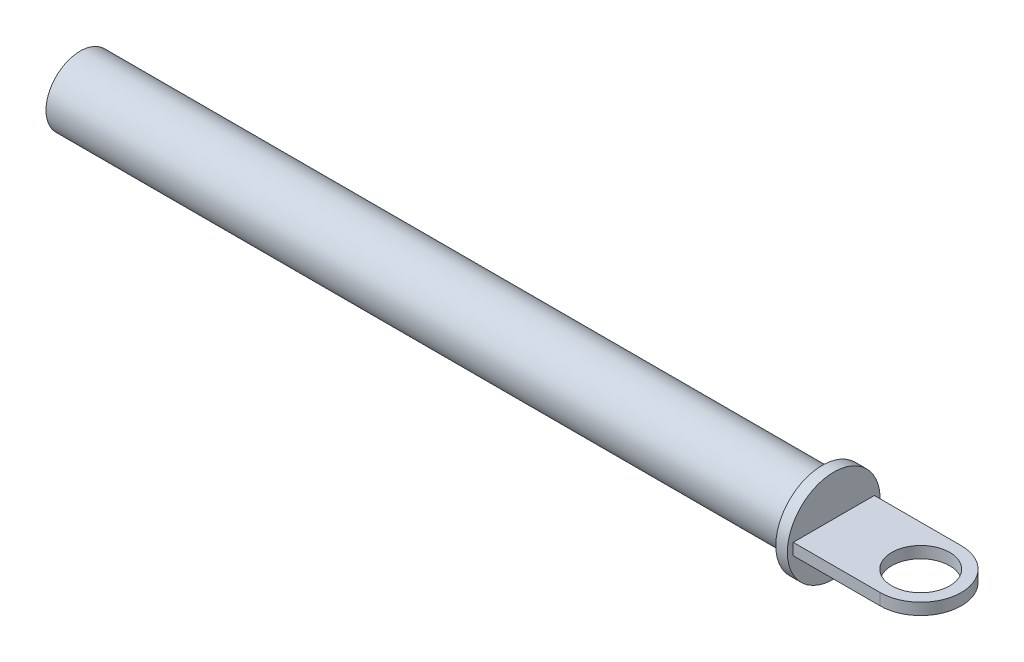
from build123d import *

# Parameters (mm, degrees)
SKETCH1_W                    = 1
SKETCH1_H                    = 4
BOSS_EXTRUDE1_DEPTH          = 1
SKETCH3_R                    = 2.95
BOSS_EXTRUDE2_DEPTH          = 64
F_5_0_5_DIAMETER_HOLE1_D     = 5
F_5_0_5_DIAMETER_HOLE1_DEPTH = 4.5


with BuildPart() as part:
    # Sketch1 → Revolve1 (revolve)
    with BuildSketch(Plane(origin=(0, 0, 0), x_dir=(-1, 0, 0), z_dir=(0, 0, -1))):
        with Locations((-32.5, 2)):
            Rectangle(SKETCH1_W, SKETCH1_H)
    revolve(axis=Axis((33, 0, 0), (-1, 0, 0)))

    # Sketch2 → Boss-Extrude1 (add)
    with BuildSketch(Plane(origin=(0, 0.5, 0), x_dir=(1, 0, 0), z_dir=(0, 1, 0))):
        with BuildLine():
            Line((33, 3.5), (33, -3.5))
            Line((33, -3.5), (40.5, -3.5))
            ThreePointArc((40.5, -3.5), (44, 0), (40.5, 3.5))
            Line((40.5, 3.5), (33, 3.5))
        make_face()
    extrude(amount=-BOSS_EXTRUDE1_DEPTH)

    # Sketch3 → Boss-Extrude2 (add)
    with BuildSketch(Plane.ZY.offset(-32)):
        Circle(SKETCH3_R)
    extrude(amount=BOSS_EXTRUDE2_DEPTH)

    # Ø5.0 (5) Diameter Hole1
    with Locations(Plane(origin=(0, -0.5, 0), x_dir=(-1, 0, 0), z_dir=(0, -1, 0))):
        with Locations((-40.5, 0)):
            Hole(F_5_0_5_DIAMETER_HOLE1_D / 2, depth=F_5_0_5_DIAMETER_HOLE1_DEPTH)


solid = part.part
